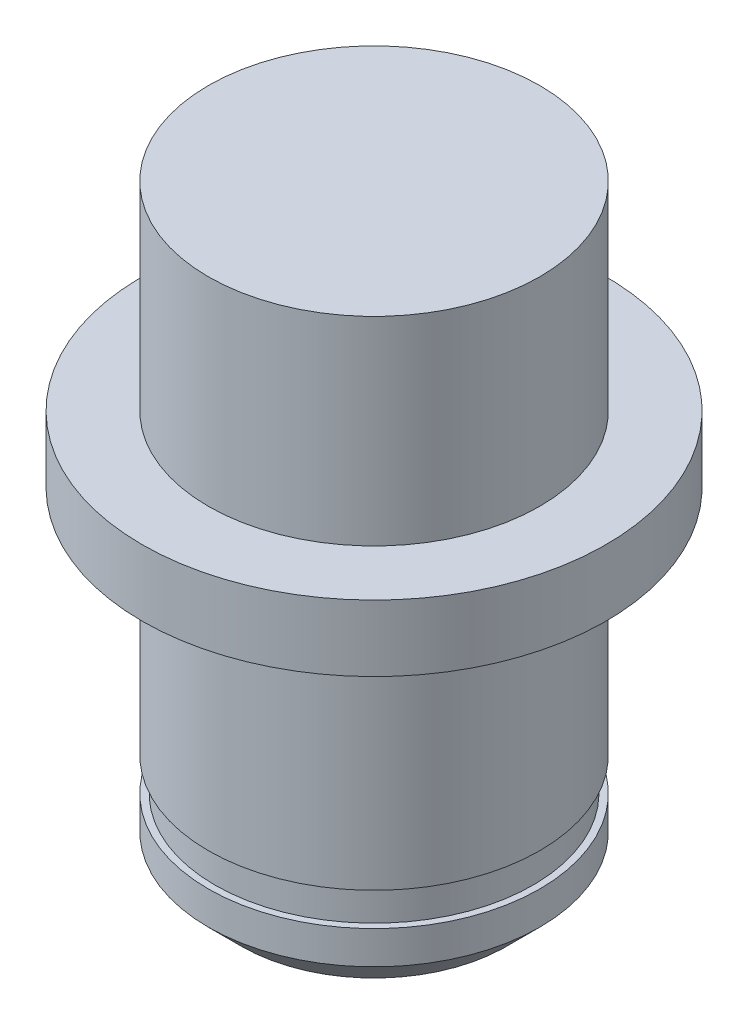
from build123d import *

# Parameters (mm, degrees)
SKETCH1_R           = 5
BOSS_EXTRUDE1_DEPTH = 18
SKETCH2_W           = 2
SKETCH2_H           = 2
SKETCH2_5_W         = 0.2
SKETCH2_5_H         = 1
CHAMFER2_SIZE       = 1


with BuildPart() as part:
    # Sketch1 → Boss-Extrude1 (new body)
    with BuildSketch(Plane(origin=(0, 0, 0), x_dir=(1, 0, 0), z_dir=(0, 1, 0))):
        Circle(SKETCH1_R)
    extrude(amount=BOSS_EXTRUDE1_DEPTH)

    # Sketch2 → Revolve1 (revolve)
    with BuildSketch(Plane(origin=(0, 0, 0), x_dir=(0, 0, -1), z_dir=(1, 0, 0))):
        with Locations((6, 11)):
            Rectangle(SKETCH2_W, SKETCH2_H)
    revolve(axis=Axis((0, 18, 0), (0, -1, 0)))

    # Sketch2<5> → Cut-Revolve1 (revolve, cut)
    with BuildSketch(Plane(origin=(0, 0, 0), x_dir=(0, 0, -1), z_dir=(1, 0, 0))):
        with Locations((4.9, 2.5)):
            Rectangle(SKETCH2_5_W, SKETCH2_5_H)
    revolve(axis=Axis((0, 18, 0), (0, -1, 0)), mode=Mode.SUBTRACT)

    # Chamfer2
    chamfer2_edges = [part.edges().sort_by_distance(p)[0] for p in [
        (-5, 0, 0),
    ]]
    chamfer(chamfer2_edges, length=CHAMFER2_SIZE)


solid = part.part
